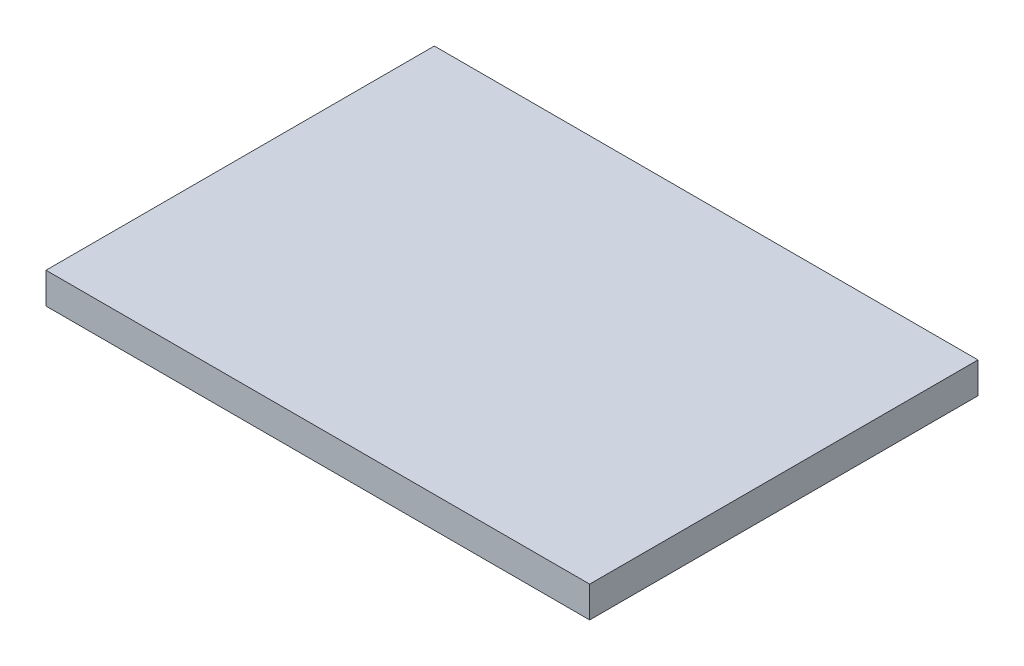
from build123d import *

# Parameters (mm, degrees)
SKETCH7_W           = 210
SKETCH7_H           = 150
BOSS_EXTRUDE1_DEPTH = 12
SKETCH7_3_W         = 210
SKETCH7_3_H         = 150
BOSS_EXTRUDE3_DEPTH = 10
SKETCH8_W           = 25
SKETCH8_H           = 2.5
CUT_EXTRUDE1_DEPTH  = 10
SKETCH8_7_W         = 25
SKETCH8_7_H         = 2.5
CUT_EXTRUDE2_DEPTH  = 10
SKETCH8_8_W         = 25
SKETCH8_8_H         = 2.5
CUT_EXTRUDE3_DEPTH  = 10
FILLET1_R           = 16
FILLET4_R           = 2


with BuildPart() as part:
    # Sketch7 → Boss-Extrude1 (new body)
    with BuildSketch(Plane(origin=(0, 0, 0), x_dir=(1, 0, 0), z_dir=(0, 1, 0))):
        with Locations((17.79379218, -5.564516129)):
            Rectangle(SKETCH7_W, SKETCH7_H)
    extrude(amount=BOSS_EXTRUDE1_DEPTH)


with BuildPart() as body_2:
    # Sketch7<3> → Boss-Extrude3 (new body)
    with BuildSketch(Plane(origin=(0, 0, 0), x_dir=(1, 0, 0), z_dir=(0, 1, 0))):
        with Locations((17.79379218, -5.564516129)):
            Rectangle(SKETCH7_3_W, SKETCH7_3_H)
    extrude(amount=BOSS_EXTRUDE3_DEPTH)

    # Sketch8 → Cut-Extrude1 (cut)
    with BuildSketch(Plane(origin=(0, 12, 0), x_dir=(1, 0, 0), z_dir=(0, 1, 0))):
        with Locations((-72.20620782, 53.185483871)):
            Rectangle(SKETCH8_W, SKETCH8_H)
        with Locations((-72.20620782, 45.685483871)):
            Rectangle(SKETCH8_W, SKETCH8_H)
        with Locations((-72.20620782, 38.185483871)):
            Rectangle(SKETCH8_W, SKETCH8_H)
        with Locations((-72.20620782, 30.685483871)):
            Rectangle(SKETCH8_W, SKETCH8_H)
        with Locations((-72.20620782, 23.185483871)):
            Rectangle(SKETCH8_W, SKETCH8_H)
        with Locations((-72.20620782, 15.685483871)):
            Rectangle(SKETCH8_W, SKETCH8_H)
        with Locations((-72.20620782, 8.185483871)):
            Rectangle(SKETCH8_W, SKETCH8_H)
        with Locations((-72.20620782, 0.685483871)):
            Rectangle(SKETCH8_W, SKETCH8_H)
        with Locations((-72.20620782, -6.814516129)):
            Rectangle(SKETCH8_W, SKETCH8_H)
        with Locations((-72.20620782, -14.314516129)):
            Rectangle(SKETCH8_W, SKETCH8_H)
        with Locations((-72.20620782, -21.814516129)):
            Rectangle(SKETCH8_W, SKETCH8_H)
        with Locations((-72.20620782, -29.314516129)):
            Rectangle(SKETCH8_W, SKETCH8_H)
        with Locations((-72.20620782, -36.814516129)):
            Rectangle(SKETCH8_W, SKETCH8_H)
        with Locations((-72.20620782, -44.314516129)):
            Rectangle(SKETCH8_W, SKETCH8_H)
        with Locations((-72.20620782, -51.814516129)):
            Rectangle(SKETCH8_W, SKETCH8_H)
        with Locations((-72.20620782, -59.314516129)):
            Rectangle(SKETCH8_W, SKETCH8_H)
        with Locations((-42.20620782, -51.814516129)):
            Rectangle(SKETCH8_W, SKETCH8_H)
        with Locations((-42.20620782, -44.314516129)):
            Rectangle(SKETCH8_W, SKETCH8_H)
        with Locations((-42.20620782, -36.814516129)):
            Rectangle(SKETCH8_W, SKETCH8_H)
        with Locations((-42.20620782, -29.314516129)):
            Rectangle(SKETCH8_W, SKETCH8_H)
        with Locations((-42.20620782, -21.814516129)):
            Rectangle(SKETCH8_W, SKETCH8_H)
        with Locations((-42.20620782, -14.314516129)):
            Rectangle(SKETCH8_W, SKETCH8_H)
        with Locations((-42.20620782, -6.814516129)):
            Rectangle(SKETCH8_W, SKETCH8_H)
        with Locations((-42.20620782, 0.685483871)):
            Rectangle(SKETCH8_W, SKETCH8_H)
        with Locations((-42.20620782, 8.185483871)):
            Rectangle(SKETCH8_W, SKETCH8_H)
        with Locations((-42.20620782, 15.685483871)):
            Rectangle(SKETCH8_W, SKETCH8_H)
        with Locations((-42.20620782, 23.185483871)):
            Rectangle(SKETCH8_W, SKETCH8_H)
        with Locations((-42.20620782, 30.685483871)):
            Rectangle(SKETCH8_W, SKETCH8_H)
        with Locations((-42.20620782, 38.185483871)):
            Rectangle(SKETCH8_W, SKETCH8_H)
        with Locations((-42.20620782, 45.685483871)):
            Rectangle(SKETCH8_W, SKETCH8_H)
        with Locations((-42.20620782, 53.185483871)):
            Rectangle(SKETCH8_W, SKETCH8_H)
        with Locations((-12.20620782, 53.185483871)):
            Rectangle(SKETCH8_W, SKETCH8_H)
        with Locations((-12.20620782, 45.685483871)):
            Rectangle(SKETCH8_W, SKETCH8_H)
    extrude(amount=-CUT_EXTRUDE1_DEPTH, mode=Mode.SUBTRACT)

    # Sketch8<7> → Cut-Extrude2 (cut)
    with BuildSketch(Plane(origin=(0, 12, 0), x_dir=(1, 0, 0), z_dir=(0, 1, 0))):
        with Locations((17.79379218, 53.185483871)):
            Rectangle(SKETCH8_7_W, SKETCH8_7_H)
        with Locations((17.79379218, 45.685483871)):
            Rectangle(SKETCH8_7_W, SKETCH8_7_H)
        with Locations((17.79379218, 38.185483871)):
            Rectangle(SKETCH8_7_W, SKETCH8_7_H)
        with Locations((17.79379218, 30.685483871)):
            Rectangle(SKETCH8_7_W, SKETCH8_7_H)
        with Locations((17.79379218, 23.185483871)):
            Rectangle(SKETCH8_7_W, SKETCH8_7_H)
        with Locations((17.79379218, 15.685483871)):
            Rectangle(SKETCH8_7_W, SKETCH8_7_H)
        with Locations((17.79379218, 8.185483871)):
            Rectangle(SKETCH8_7_W, SKETCH8_7_H)
        with Locations((17.79379218, 0.685483871)):
            Rectangle(SKETCH8_7_W, SKETCH8_7_H)
        with Locations((17.79379218, -6.814516129)):
            Rectangle(SKETCH8_7_W, SKETCH8_7_H)
        with Locations((17.79379218, -14.314516129)):
            Rectangle(SKETCH8_7_W, SKETCH8_7_H)
        with Locations((17.79379218, -21.814516129)):
            Rectangle(SKETCH8_7_W, SKETCH8_7_H)
        with Locations((17.79379218, -29.314516129)):
            Rectangle(SKETCH8_7_W, SKETCH8_7_H)
        with Locations((17.79379218, -36.814516129)):
            Rectangle(SKETCH8_7_W, SKETCH8_7_H)
        with Locations((17.79379218, -44.314516129)):
            Rectangle(SKETCH8_7_W, SKETCH8_7_H)
        with Locations((17.79379218, -51.814516129)):
            Rectangle(SKETCH8_7_W, SKETCH8_7_H)
        with Locations((17.79379218, -59.314516129)):
            Rectangle(SKETCH8_7_W, SKETCH8_7_H)
        with Locations((17.79379218, -66.814516129)):
            Rectangle(SKETCH8_7_W, SKETCH8_7_H)
        with Locations((17.79379218, -74.314516129)):
            Rectangle(SKETCH8_7_W, SKETCH8_7_H)
        with Locations((47.79379218, 53.185483871)):
            Rectangle(SKETCH8_7_W, SKETCH8_7_H)
        with Locations((47.79379218, 45.685483871)):
            Rectangle(SKETCH8_7_W, SKETCH8_7_H)
        with Locations((77.79379218, 53.185483871)):
            Rectangle(SKETCH8_7_W, SKETCH8_7_H)
        with Locations((77.79379218, 45.685483871)):
            Rectangle(SKETCH8_7_W, SKETCH8_7_H)
        with Locations((77.79379218, 38.185483871)):
            Rectangle(SKETCH8_7_W, SKETCH8_7_H)
        with Locations((77.79379218, 30.685483871)):
            Rectangle(SKETCH8_7_W, SKETCH8_7_H)
        with Locations((77.79379218, 23.185483871)):
            Rectangle(SKETCH8_7_W, SKETCH8_7_H)
        with Locations((77.79379218, 15.685483871)):
            Rectangle(SKETCH8_7_W, SKETCH8_7_H)
        with Locations((77.79379218, 8.185483871)):
            Rectangle(SKETCH8_7_W, SKETCH8_7_H)
        with Locations((77.79379218, 0.685483871)):
            Rectangle(SKETCH8_7_W, SKETCH8_7_H)
        with Locations((77.79379218, -6.814516129)):
            Rectangle(SKETCH8_7_W, SKETCH8_7_H)
        with Locations((77.79379218, -14.314516129)):
            Rectangle(SKETCH8_7_W, SKETCH8_7_H)
        with Locations((77.79379218, -21.814516129)):
            Rectangle(SKETCH8_7_W, SKETCH8_7_H)
        with Locations((77.79379218, -29.314516129)):
            Rectangle(SKETCH8_7_W, SKETCH8_7_H)
        with Locations((77.79379218, -36.814516129)):
            Rectangle(SKETCH8_7_W, SKETCH8_7_H)
        with Locations((77.79379218, -44.314516129)):
            Rectangle(SKETCH8_7_W, SKETCH8_7_H)
        with Locations((77.79379218, -51.814516129)):
            Rectangle(SKETCH8_7_W, SKETCH8_7_H)
        with Locations((77.79379218, -59.314516129)):
            Rectangle(SKETCH8_7_W, SKETCH8_7_H)
    extrude(amount=-CUT_EXTRUDE2_DEPTH, mode=Mode.SUBTRACT)

    # Sketch8<8> → Cut-Extrude3 (cut)
    with BuildSketch(Plane(origin=(0, 12, 0), x_dir=(1, 0, 0), z_dir=(0, 1, 0))):
        with Locations((107.79379218, 53.185483871)):
            Rectangle(SKETCH8_8_W, SKETCH8_8_H)
        with Locations((107.79379218, 45.685483871)):
            Rectangle(SKETCH8_8_W, SKETCH8_8_H)
        with Locations((107.79379218, 38.185483871)):
            Rectangle(SKETCH8_8_W, SKETCH8_8_H)
        with Locations((107.79379218, 30.685483871)):
            Rectangle(SKETCH8_8_W, SKETCH8_8_H)
        with Locations((107.79379218, 23.185483871)):
            Rectangle(SKETCH8_8_W, SKETCH8_8_H)
        with Locations((107.79379218, 15.685483871)):
            Rectangle(SKETCH8_8_W, SKETCH8_8_H)
        with Locations((107.79379218, 8.185483871)):
            Rectangle(SKETCH8_8_W, SKETCH8_8_H)
        with Locations((107.79379218, 0.685483871)):
            Rectangle(SKETCH8_8_W, SKETCH8_8_H)
        with Locations((107.79379218, -6.814516129)):
            Rectangle(SKETCH8_8_W, SKETCH8_8_H)
        with Locations((107.79379218, -14.314516129)):
            Rectangle(SKETCH8_8_W, SKETCH8_8_H)
    extrude(amount=-CUT_EXTRUDE3_DEPTH, mode=Mode.SUBTRACT)

    # Fillet1
    fillet1_edges = [body_2.edges().sort_by_distance(p)[0] for p in [
        (-87.20620782, 5, -69.435483871),
        (122.79379218, 5, -69.435483871),
        (122.79379218, 5, 80.564516129),
        (-87.20620782, 5, 80.564516129),
    ]]
    fillet(fillet1_edges, radius=FILLET1_R)

    # Fillet4
    fillet4_edges = [body_2.edges().sort_by_distance(p)[0] for p in [
        (17.79379218, 10, -69.435483871),
        (122.79379218, 10, 5.564516129),
        (-87.20620782, 10, 5.564516129),
        (17.79379218, 10, 80.564516129),
        (-82.519916319, 10, -64.74919237),
        (-82.519916319, 10, 75.878224628),
        (118.107500679, 10, 75.878224628),
        (118.107500679, 10, -64.74919237),
    ]]
    fillet(fillet4_edges, radius=FILLET4_R)


solid = Compound([part.part, body_2.part])
